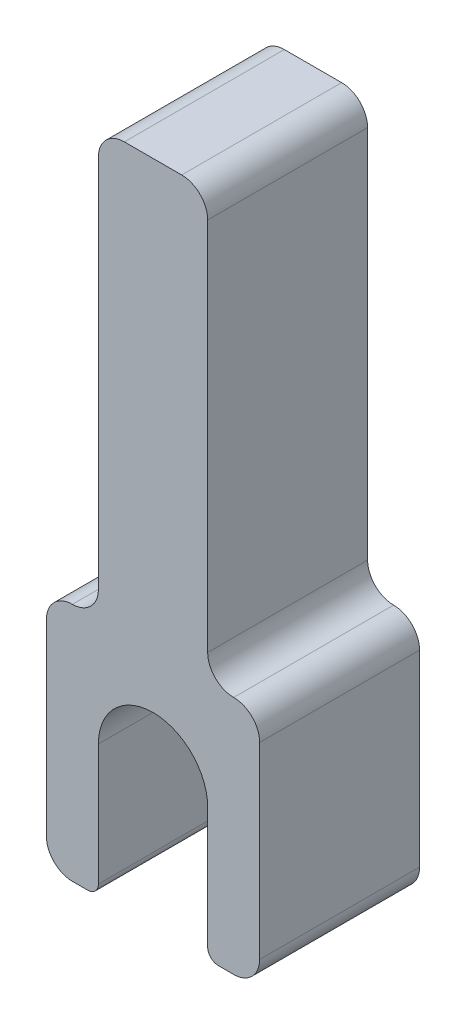
from build123d import *

# Parameters (mm, degrees)
BOSS_EXTRUDE1_DEPTH = 6
FILLET1_R           = 0.975
FILLET2_R           = 0.4


with BuildPart() as part:
    # Sketch1 → Boss-Extrude1 (new body)
    with BuildSketch(Plane.XY):
        with BuildLine():
            Line((-4, -4.95), (-4, 4.05))
            Line((-4, 4.05), (-2.05, 4.05))
            Line((-2.05, 4.05), (-2.05, 20.05))
            Line((-2.05, 20.05), (2.05, 20.05))
            Line((2.05, 20.05), (2.05, 4.05))
            Line((2.05, 4.05), (4, 4.05))
            Line((4, 4.05), (4, -4.95))
            Line((4, -4.95), (2.05, -4.95))
            Line((2.05, -4.95), (2.05, 0))
            ThreePointArc((2.05, 0), (0, 2.05), (-2.05, 0))
            Line((-2.05, 0), (-2.05, -4.95))
            Line((-2.05, -4.95), (-4, -4.95))
        make_face()
    extrude(amount=BOSS_EXTRUDE1_DEPTH)

    # Fillet1
    fillet1_edges = [part.edges().sort_by_distance(p)[0] for p in [
        (-4, -4.95, 3),
        (-4, 4.05, 3),
        (-2.05, 4.05, 3),
        (4, 4.05, 3),
        (4, -4.95, 3),
        (2.05, 4.05, 3),
        (-2.05, 20.05, 3),
        (2.05, 20.05, 3),
    ]]
    fillet(fillet1_edges, radius=FILLET1_R - 0.0001)  # a hair under: the kernel refuses the full size

    # Fillet2
    fillet2_edges = [part.edges().sort_by_distance(p)[0] for p in [
        (2.05, -4.95, 3),
        (-2.05, -4.95, 3),
    ]]
    fillet(fillet2_edges, radius=FILLET2_R)


solid = part.part
